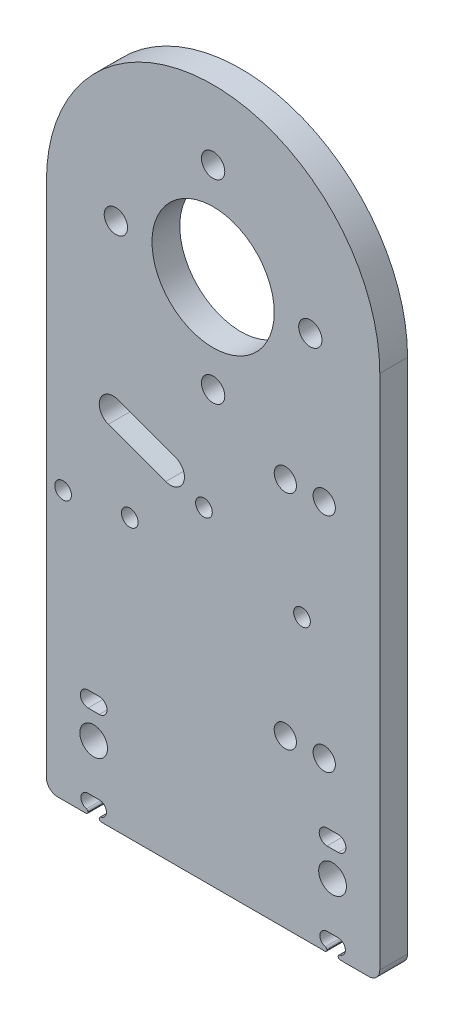
from build123d import *

# Parameters (mm, degrees)
SKETCH1_R           = 11
SKETCH1_R_2         = 2.5
SKETCH1_R_3         = 2.1
SKETCH1_R_4         = 1.5
BOSS_EXTRUDE1_DEPTH = 2.5
CUT_EXTRUDE1_DEPTH  = 84.254129027
SKETCH3_R           = 2
CUT_EXTRUDE2_DEPTH  = 84.254129027
FILLET1_R           = 0.4
FILLET2_R           = 2


with BuildPart() as part:
    # Sketch1 → Boss-Extrude1 (new, symmetric)
    with BuildSketch(Plane.XY):
        with BuildLine():
            Line((-30, -47.5), (-22.5, -47.5))
            Line((-22.5, -47.5), (-22.5, -46.8))
            ThreePointArc((-22.5, -46.8), (-23.8, -45.5), (-22.5, -44.2))
            Line((-22.5, -44.2), (-20.5, -44.2))
            ThreePointArc((-20.5, -44.2), (-19.2, -45.5), (-20.5, -46.8))
            Line((-20.5, -46.8), (-20.5, -47.5))
            Line((-20.5, -47.5), (20.5, -47.5))
            Line((20.5, -47.5), (20.5, -46.8))
            ThreePointArc((20.5, -46.8), (19.2, -45.5), (20.5, -44.2))
            Line((20.5, -44.2), (22.5, -44.2))
            ThreePointArc((22.5, -44.2), (23.8, -45.5), (22.5, -46.8))
            Line((22.5, -46.8), (22.5, -47.5))
            Line((22.5, -47.5), (30, -47.5))
            Line((30, -47.5), (30, 47.5))
            ThreePointArc((30, 47.5), (0, 77.5), (-30, 47.5))
            Line((-30, 47.5), (-30, -47.5))
        make_face()
        with Locations((0, 47.5)):
            Circle(SKETCH1_R, mode=Mode.SUBTRACT)
        with Locations((21.5, -35.5)):
            Circle(SKETCH1_R_2, mode=Mode.SUBTRACT)
        with Locations((-21.5, -35.5)):
            Circle(SKETCH1_R_2, mode=Mode.SUBTRACT)
        with Locations((0, 30)):
            Circle(SKETCH1_R_3, mode=Mode.SUBTRACT)
        with Locations((-17.5, 47.5)):
            Circle(SKETCH1_R_3, mode=Mode.SUBTRACT)
        with Locations((0, 65)):
            Circle(SKETCH1_R_3, mode=Mode.SUBTRACT)
        with Locations((17.5, 47.5)):
            Circle(SKETCH1_R_3, mode=Mode.SUBTRACT)
        with Locations((-27, 0.779569979)):
            Circle(SKETCH1_R_4, mode=Mode.SUBTRACT)
        with Locations((-1.65030964, 10.779569979)):
            Circle(SKETCH1_R_4, mode=Mode.SUBTRACT)
        with Locations((16, 2.529392469)):
            Circle(SKETCH1_R_4, mode=Mode.SUBTRACT)
        with Locations((-15, 2.529392469)):
            Circle(SKETCH1_R_4, mode=Mode.SUBTRACT)
        with BuildLine():
            Line((20.5, -28.1), (22.5, -28.1))
            ThreePointArc((22.5, -28.1), (23.9, -29.5), (22.5, -30.9))
            Line((22.5, -30.9), (20.5, -30.9))
            ThreePointArc((20.5, -30.9), (19.1, -29.5), (20.5, -28.1))
        make_face(mode=Mode.SUBTRACT)
        with BuildLine():
            Line((-20.5, -28.1), (-22.5, -28.1))
            ThreePointArc((-22.5, -28.1), (-23.9, -29.5), (-22.5, -30.9))
            Line((-22.5, -30.9), (-20.5, -30.9))
            ThreePointArc((-20.5, -30.9), (-19.1, -29.5), (-20.5, -28.1))
        make_face(mode=Mode.SUBTRACT)
    extrude(amount=BOSS_EXTRUDE1_DEPTH, both=True)

    # Sketch2 → Cut-Extrude1 (cut, through all)
    with BuildSketch(Plane(origin=(0, 0, -2.5), x_dir=(-1, 0, 0), z_dir=(0, 0, -1))):
        with BuildLine():
            Line((8.51843153, 11.388546871), (18.855050358, 15.150768448))
            ThreePointArc((18.855050358, 15.150768448), (20.349231552, 18.355050358), (17.144949642, 19.849231552))
            Line((17.144949642, 19.849231552), (6.808330813, 16.087009975))
            ThreePointArc((6.808330813, 16.087009975), (5.314149619, 12.882728065), (8.51843153, 11.388546871))
        make_face()
    extrude(amount=-CUT_EXTRUDE1_DEPTH, mode=Mode.SUBTRACT)

    # Sketch3 → Cut-Extrude2 (cut, through all)
    with BuildSketch(Plane.XY.offset(2.5)):
        with Locations((13, -17.5)):
            Circle(SKETCH3_R)
        with Locations((20, -17.5)):
            Circle(SKETCH3_R)
        with Locations((13, 22.5)):
            Circle(SKETCH3_R)
        with Locations((20, 22.5)):
            Circle(SKETCH3_R)
    extrude(amount=-CUT_EXTRUDE2_DEPTH, mode=Mode.SUBTRACT)

    # Fillet1
    # the kernel refuses this fillet: 0.4 mm, written as the material it takes off along each edge
    with BuildSketch(Plane(origin=(22.5, -47.5, -3.5), x_dir=(1, 0, 0), z_dir=(0, 0, 1))) as fillet1_piece_1:
        with BuildLine():
            CenterArc((FILLET1_R, FILLET1_R), FILLET1_R, 180, 90)
            Line((0, FILLET1_R), (0, 0))
            Line((0, 0), (FILLET1_R, 0))
        make_face()
    extrude(amount=7, mode=Mode.SUBTRACT)
    with BuildSketch(Plane(origin=(22.5, -46.8, -3.38067791), x_dir=(0, -1, 0), z_dir=(0, 0, 1))) as fillet1_piece_2:
        with BuildLine():
            CenterArc((0.352271164, 0.4), FILLET1_R, 193.608960631, 76.391039369)
            ThreePointArc((-0.036498522, 0.305882353), (-0.00915688, 0.154026098), (0, 0))
            Line((0, 0), (0.352271164, 0))
        make_face()
    extrude(amount=6.761355821, mode=Mode.SUBTRACT)
    with BuildSketch(Plane(origin=(20.5, -47.5, -3.5), x_dir=(-1, 0, 0), z_dir=(0, 0, 1)), Plane(origin=(-20.5, -47.5, -3.5), x_dir=(0, 1, 0), z_dir=(0, 0, 1)), Plane(origin=(-22.5, -47.5, -3.5), x_dir=(-1, 0, 0), z_dir=(0, 0, 1))) as fillet1_piece_3:
        with BuildLine():
            CenterArc((FILLET1_R, -FILLET1_R), FILLET1_R, 90, 90)
            Line((0, -FILLET1_R), (0, 0))
            Line((0, 0), (FILLET1_R, 0))
        make_face()
    extrude(amount=7, mode=Mode.SUBTRACT)
    with BuildSketch(Plane(origin=(20.5, -46.8, -3.38067791), x_dir=(-0.9929562463238142, 0.11848161412860948, 0), z_dir=(0, 0, 1))) as fillet1_piece_4:
        with BuildLine():
            CenterArc((0.355444842, 0.397182499), FILLET1_R, 186.804480315, 76.391039369)
            Line((-0.041737656, 0.349789853), (0, 0))
            ThreePointArc((0, 0), (0.154026098, 0.00915688), (0.308052197, 0))
        make_face()
    extrude(amount=6.761355821, mode=Mode.SUBTRACT)
    with BuildSketch(Plane(origin=(-20.5, -46.8, -3.38067791), x_dir=(0.9929562463238113, 0.11848161412863496, 0), z_dir=(0, 0, 1))) as fillet1_piece_5:
        with BuildLine():
            CenterArc((0.355444842, -0.397182499), FILLET1_R, 96.804480315, 76.391039369)
            Line((-0.041737656, -0.349789853), (0, 0))
            ThreePointArc((0, 0), (0.154026098, -0.00915688), (0.308052197, 0))
        make_face()
    extrude(amount=6.761355821, mode=Mode.SUBTRACT)
    with BuildSketch(Plane(origin=(-22.5, -46.8, -3.38067791), x_dir=(0, -1, 0), z_dir=(0, 0, 1))) as fillet1_piece_6:
        with BuildLine():
            CenterArc((0.352271164, -0.4), FILLET1_R, 90, 76.391039369)
            ThreePointArc((-0.036498522, -0.305882353), (-0.00915688, -0.154026098), (0, 0))
            Line((0, 0), (0.352271164, 0))
        make_face()
    extrude(amount=6.761355821, mode=Mode.SUBTRACT)

    # Fillet2
    fillet2_edges = [part.edges().sort_by_distance(p)[0] for p in [
        (30, -47.5, 0),
        (-30, -47.5, 0),
    ]]
    fillet(fillet2_edges, radius=FILLET2_R)


solid = part.part
